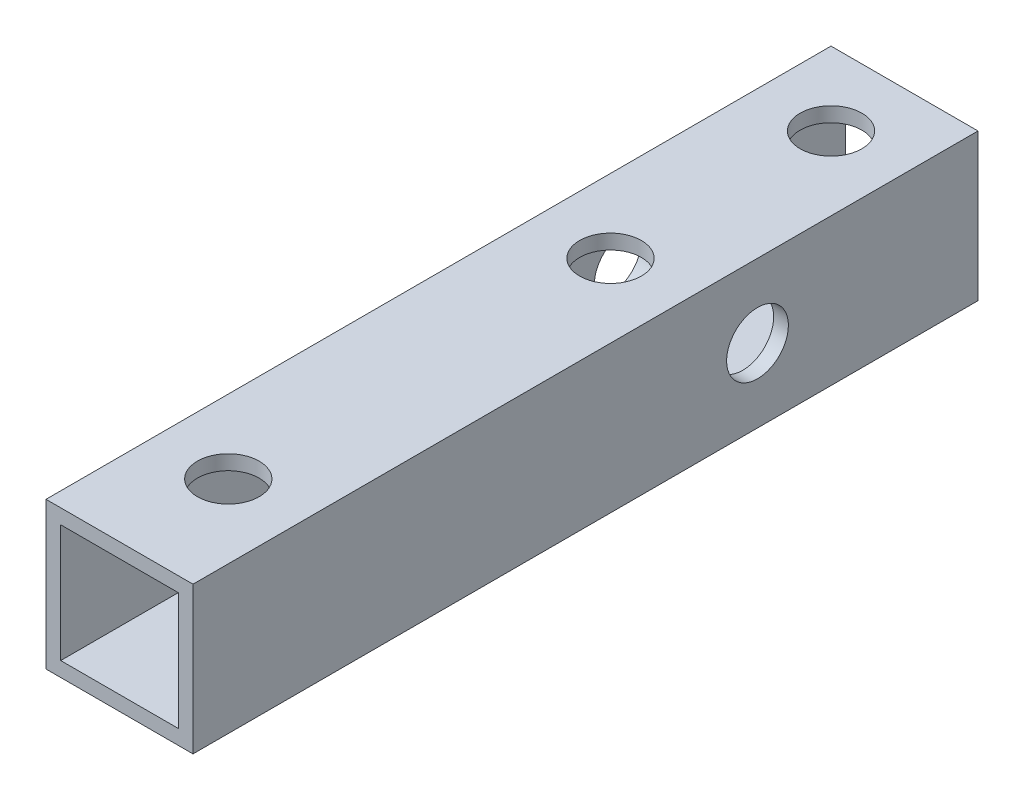
from build123d import *

# Parameters (mm, degrees)
SKETCH_1_W          = 10
SKETCH_1_H          = 10
SKETCH_1_W_2        = 8
SKETCH_1_H_2        = 8
EXTRUDE_1_DEPTH     = 53.4
SKETCH_2_R          = 2.1
CUT_EXTRUDE_1_DEPTH = 55.557859196
SKETCH_3_R          = 2.1
CUT_EXTRUDE_2_DEPTH = 55.557859196


with BuildPart() as part:
    # ｽｹｯﾁ1 → 押し出し-薄板1 (new body)
    with BuildSketch(Plane.XY):
        Rectangle(SKETCH_1_W, SKETCH_1_H)
        Rectangle(SKETCH_1_W_2, SKETCH_1_H_2, mode=Mode.SUBTRACT)
    extrude(amount=EXTRUDE_1_DEPTH)

    # ｽｹｯﾁ2 → ｶｯﾄ - 押し出し1 (cut, through all)
    with BuildSketch(Plane(origin=(5, 0, 0), x_dir=(0, 0, -1), z_dir=(1, 0, 0))):
        with Locations((-15, 0)):
            Circle(SKETCH_2_R)
    extrude(amount=-CUT_EXTRUDE_1_DEPTH, mode=Mode.SUBTRACT)

    # ｽｹｯﾁ3 → ｶｯﾄ - 押し出し2 (cut, through all)
    with BuildSketch(Plane(origin=(0, 5, 0), x_dir=(1, 0, 0), z_dir=(0, 1, 0))):
        with Locations((0, -5)):
            Circle(SKETCH_3_R)
        with Locations((0, -20)):
            Circle(SKETCH_3_R)
        with Locations((0, -46)):
            Circle(SKETCH_3_R)
    extrude(amount=-CUT_EXTRUDE_2_DEPTH, mode=Mode.SUBTRACT)


solid = part.part
